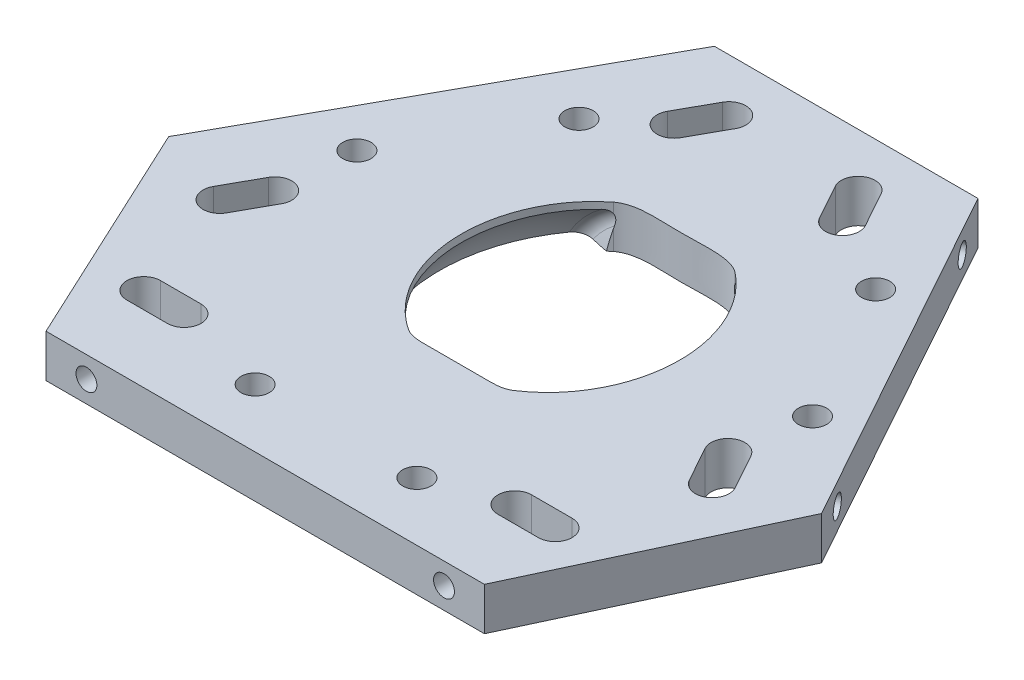
from build123d import *

# Parameters (mm, degrees)
BOSS_EXTRUDE1_DEPTH = 5.291666667
SCALE1_SCALE        = 1.2
SKETCH3_R           = 13
CUT_EXTRUDE2_DEPTH  = 40
SKETCH6_R           = 1.55
CUT_EXTRUDE4_DEPTH  = 6
SKETCH7_R           = 1.55
CUT_EXTRUDE5_DEPTH  = 7
SKETCH8_R           = 1.55
CUT_EXTRUDE6_DEPTH  = 7
SKETCH9_R           = 2.1
CUT_EXTRUDE7_DEPTH  = 10
CUT_EXTRUDE8_DEPTH  = 10
CUT_EXTRUDE9_DEPTH  = 10


# Read off the part's stored shape, not the designer's step: Cavity1
with BuildPart() as part:
    # Sketch1 → Boss-Extrude1 (new body)
    with BuildSketch(Plane(origin=(0, 0, 0), x_dir=(1, 0, 0), z_dir=(0, 1, 0))):
        Polygon((0, 0), (54.205585529, 0), (67.458894217, 28.421812201), (43.397792765, 71.829188267), (10.807792765, 71.829188267), (-13.253308688, 28.421812201), align=None)
    extrude(amount=BOSS_EXTRUDE1_DEPTH)


with BuildPart() as part_1:
    # Scale1: scaled about (27.102792765, 2.645833333, -33.072398266)
    add(part.part.scale(SCALE1_SCALE).moved(Location((-5.420558553, -0.529166667, 6.614479653))))

    # Sketch3 → Cut-Extrude2 (cut)
    with BuildSketch(Plane(origin=(0, 5.820833333, 0), x_dir=(1, 0, 0), z_dir=(0, 1, 0))):
        with Locations(Location((27.143114508, 36.416851647, 0), (0, 0, 270))):
            Circle(SKETCH3_R)
    extrude(amount=-CUT_EXTRUDE2_DEPTH, mode=Mode.SUBTRACT)

    # Sketch6 → Cut-Extrude4 (cut)
    with BuildSketch(Plane.XY.offset(6.614479653)):
        with Locations((0.579441447, 2.645833333)):
            Circle(SKETCH6_R)
        with Locations((53.626144082, 2.645833333)):
            Circle(SKETCH6_R)
    extrude(amount=-CUT_EXTRUDE4_DEPTH, mode=Mode.SUBTRACT)

    # Sketch7 → Cut-Extrude5 (cut)
    with BuildSketch(Plane(origin=(69.434628405, 0, -38.488243009), x_dir=(-0.48480962024633945, 0, -0.8746197071393944), z_dir=(0.8746197071393945, 0, -0.4848096202463395))):
        with Locations((-6.572947912, 2.645833333)):
            Circle(SKETCH7_R)
        with Locations((40.983052088, 2.645833333)):
            Circle(SKETCH7_R)
    extrude(amount=-CUT_EXTRUDE5_DEPTH, mode=Mode.SUBTRACT)

    # Sketch8 → Cut-Extrude6 (cut)
    with BuildSketch(Plane(origin=(-27.96954364, 0, -15.503771205), x_dir=(-0.48480962024633495, 0, 0.8746197071393971), z_dir=(-0.8746197071393971, 0, -0.48480962024633495))):
        with Locations((-67.262441424, 2.645833333)):
            Circle(SKETCH8_R)
        with Locations((-19.706441424, 2.645833333)):
            Circle(SKETCH8_R)
    extrude(amount=-CUT_EXTRUDE6_DEPTH, mode=Mode.SUBTRACT)

    # Sketch9 → Cut-Extrude7 (cut)
    with BuildSketch(Plane(origin=(0, 5.820833333, 0), x_dir=(1, 0, 0), z_dir=(0, 1, 0))):
        with Locations(Location((50.747251871, 60.302389061, 0), (0, 0, 270))):
            Circle(SKETCH9_R)
        with Locations(Location((62.378214551, 39.309039944, 0), (0, 0, 270))):
            Circle(SKETCH9_R)
        with Locations(Location((6.827781741, 60.212867103, 0), (0, 0, 270))):
            Circle(SKETCH9_R)
        with Locations(Location((16.938391094, 2.054239483, 0), (0, 0, 270))):
            Circle(SKETCH9_R)
        with Locations(Location((40.938391094, 2.054239483, 0), (0, 0, 270))):
            Circle(SKETCH9_R)
        with Locations(Location((-5.576884191, 39.667204225, 0), (0, 0, 270))):
            Circle(SKETCH9_R)
    extrude(amount=-CUT_EXTRUDE7_DEPTH, mode=Mode.SUBTRACT)

    # Cavity1 outline → Cavity1 (revolve, cut)
    with BuildSketch(Plane(origin=(29.100070557, -9.029166667, 0), x_dir=(1, 0, 0), z_dir=(0, -1, 0))):
        with BuildLine():
            ThreePointArc((16.503900961, -21.270597295), (16.144807437, -20.949197034), (15.677087754, -20.833073891))
            Line((15.677087754, -20.833073891), (8.5, -20.833073891))
            Line((8.5, -20.833073891), (8.5, -50.725118236))
            ThreePointArc((8.5, -50.725118236), (11.674469266, -51.324260415), (14.802095712, -52.133073918))
            ThreePointArc((14.802095712, -52.133073918), (16.075454008, -52.084788022), (17.061194873, -51.2772684))
            ThreePointArc((17.061194873, -51.2772684), (21.250000001, -36.19096173), (16.503900961, -21.270597295))
        make_face()
    revolve(axis=Axis((29.100070557, -9.029166667, 0), (0, 0, 1)), mode=Mode.SUBTRACT)

    # Sketch10 → Cut-Extrude8 (cut)
    with BuildSketch(Plane(origin=(0, 5.820833333, 0), x_dir=(1, 0, 0), z_dir=(0, 1, 0))):
        with BuildLine():
            Line((24.075273998, 19.833073891), (34.124867116, 19.833073891))
            add(Edge.make_bspline(
                [(34.124867116, 19.833073891), (34.595564087, 19.833073891), (35.066705459, 19.862629797), (35.759275301, 19.991320107), (35.988654293, 20.04936948), (36.429354971, 20.203625461), (36.641500061, 20.300849184), (36.841076926, 20.428854144)],
                knots=[0, 0, 0, 0, 0.5, 0.5, 0.75, 0.75, 1, 1, 1, 1], degree=3))
            add(Edge.make_bspline(
                [(36.841076926, 20.428854144), (38.140190966, 21.262082192), (39.289886944, 22.257058671), (40.822208034, 23.957608996), (41.302936177, 24.56401827), (42.179397298, 25.819737339), (42.576910445, 26.470024824), (43.294408496, 27.813303871), (43.614769698, 28.506088161), (44.036395478, 29.577716697), (44.167143249, 29.940681272), (44.406134081, 30.668697084), (44.514824692, 31.034802281), (45.006385792, 32.875400866), (45.233430203, 34.380141219), (45.321021554, 36.686356068), (45.307023472, 37.451946272), (45.195596805, 38.96916245), (45.098202174, 39.722102539), (44.819785518, 41.21661071), (44.639215498, 41.958240258), (44.189505784, 43.429455273), (43.923594101, 44.14784158), (43.01266144, 46.238417415), (42.25312036, 47.553109123), (40.862183361, 49.394542544), (40.361452222, 49.9786274), (39.293155104, 51.074287362), (38.724246899, 51.587747439), (38.11760654, 52.063898432)],
                knots=[0, 0, 0, 0, 0.125, 0.125, 0.1875, 0.1875, 0.25, 0.25, 0.3125, 0.3125, 0.34375, 0.34375, 0.375, 0.375, 0.5, 0.5, 0.5625, 0.5625, 0.625, 0.625, 0.6875, 0.6875, 0.75, 0.75, 0.875, 0.875, 0.9375, 0.9375, 1, 1, 1, 1], degree=3))
            add(Edge.make_bspline(
                [(38.11760654, 52.063898432), (37.808978952, 52.306139705), (37.470408276, 52.487550678), (36.757734469, 52.778187352), (36.380844193, 52.886581075), (35.252317903, 53.127500299), (34.48899845, 53.186875664), (32.953727289, 53.225952781), (32.182556057, 53.206606323), (30.643121731, 53.165630882), (29.873380962, 53.1465845), (28.333277229, 53.146479825), (27.56322391, 53.165473763), (26.023330935, 53.206433331), (25.253379732, 53.226463769), (23.712635336, 53.18627111), (22.944390484, 53.127039205), (21.814543732, 52.885529169), (21.441580347, 52.777541647), (20.909088672, 52.561053175), (20.735575622, 52.47939934), (20.399026204, 52.291134357), (20.235577441, 52.18402152), (20.082534574, 52.063898432)],
                knots=[0, 0, 0, 0, 0.0625, 0.0625, 0.125, 0.125, 0.25, 0.25, 0.375, 0.375, 0.5, 0.5, 0.625, 0.625, 0.75, 0.75, 0.875, 0.875, 0.9375, 0.9375, 0.96875, 0.96875, 1, 1, 1, 1], degree=3))
            add(Edge.make_bspline(
                [(20.082534574, 52.063898432), (18.868568603, 51.111058591), (17.81138382, 50.017637279), (16.660204814, 48.498155443), (16.438541537, 48.186572324), (16.012683502, 47.547742535), (15.808362457, 47.220092413), (15.229363996, 46.226433114), (14.88576748, 45.545696427), (14.277441262, 44.150191105), (14.013250549, 43.43518989), (13.564834087, 41.970681647), (13.380971399, 41.219843332), (12.961548848, 38.968650418), (12.850291287, 37.452472779), (12.922670064, 35.537931052), (12.947870807, 35.152909894), (13.01947572, 34.388955535), (13.065826253, 34.009568714), (13.236125584, 32.879081952), (13.391267785, 32.135642374), (13.783118297, 30.668793922), (14.02012892, 29.945459289), (14.439994672, 28.876260132), (14.5912529, 28.521302828), (14.912751103, 27.82410918), (15.08290647, 27.481815008), (15.979948803, 25.801344263), (16.843578634, 24.554792005), (18.122563901, 23.13024145), (18.389385228, 22.851243836), (18.939278201, 22.312870145), (19.222220105, 22.053467392), (20.095300107, 21.304939415), (20.709614661, 20.845399224), (21.359064189, 20.428854144)],
                knots=[0, 0, 0, 0, 0.125, 0.125, 0.15625, 0.15625, 0.1875, 0.1875, 0.25, 0.25, 0.3125, 0.3125, 0.375, 0.375, 0.5, 0.5, 0.53125, 0.53125, 0.5625, 0.5625, 0.625, 0.625, 0.6875, 0.6875, 0.71875, 0.71875, 0.75, 0.75, 0.875, 0.875, 0.90625, 0.90625, 0.9375, 0.9375, 1, 1, 1, 1], degree=3))
            add(Edge.make_bspline(
                [(21.359064189, 20.428854144), (21.559196117, 20.300493176), (21.771268075, 20.203625807), (22.210478841, 20.049632126), (22.438146944, 19.991875697), (23.132664243, 19.862646491), (23.604177168, 19.833073891), (24.075273998, 19.833073891)],
                knots=[0, 0, 0, 0, 0.25, 0.25, 0.5, 0.5, 1, 1, 1, 1], degree=3))
        make_face()
    extrude(amount=-CUT_EXTRUDE8_DEPTH, mode=Mode.SUBTRACT)

    # Sketch11 → Cut-Extrude9 (cut)
    with BuildSketch(Plane(origin=(0, 5.820833333, 0), x_dir=(1, 0, 0), z_dir=(0, 1, 0))):
        with BuildLine():
            Line((51.626144082, 8.385520347), (57.626144082, 8.385520347))
            ThreePointArc((57.626144082, 8.385520347), (60.126144082, 5.885520347), (57.626144082, 3.385520347))
            Line((57.626144082, 3.385520347), (51.626144082, 3.385520347))
            ThreePointArc((51.626144082, 3.385520347), (49.126144082, 5.885520347), (51.626144082, 8.385520347))
        make_face()
        with BuildLine():
            Line((38.880214934, 72.98321065), (41.789072655, 67.735492407))
            ThreePointArc((41.789072655, 67.735492407), (40.814547438, 64.336919089), (37.41597412, 65.311444306))
            Line((37.41597412, 65.311444306), (34.507116398, 70.559162549))
            ThreePointArc((34.507116398, 70.559162549), (35.481641615, 73.957735867), (38.880214934, 72.98321065))
        make_face()
        with BuildLine():
            Line((62.905440475, 29.640556443), (65.814298196, 24.3928382))
            ThreePointArc((65.814298196, 24.3928382), (64.839772979, 20.994264882), (61.44119966, 21.968790099))
            Line((61.44119966, 21.968790099), (58.532341939, 27.216508342))
            ThreePointArc((58.532341939, 27.216508342), (59.506867156, 30.61508166), (62.905440475, 29.640556443))
        make_face()
    cut_extrude9 = extrude(amount=-CUT_EXTRUDE9_DEPTH, mode=Mode.SUBTRACT)

    # Mirror1: Cut-Extrude9 across plane
    add(cut_extrude9.mirror(Plane(origin=(27.102792765, 0, 0), x_dir=(0, 0, 1), z_dir=(1, 0, 0))), mode=Mode.SUBTRACT)


solid = part_1.part
